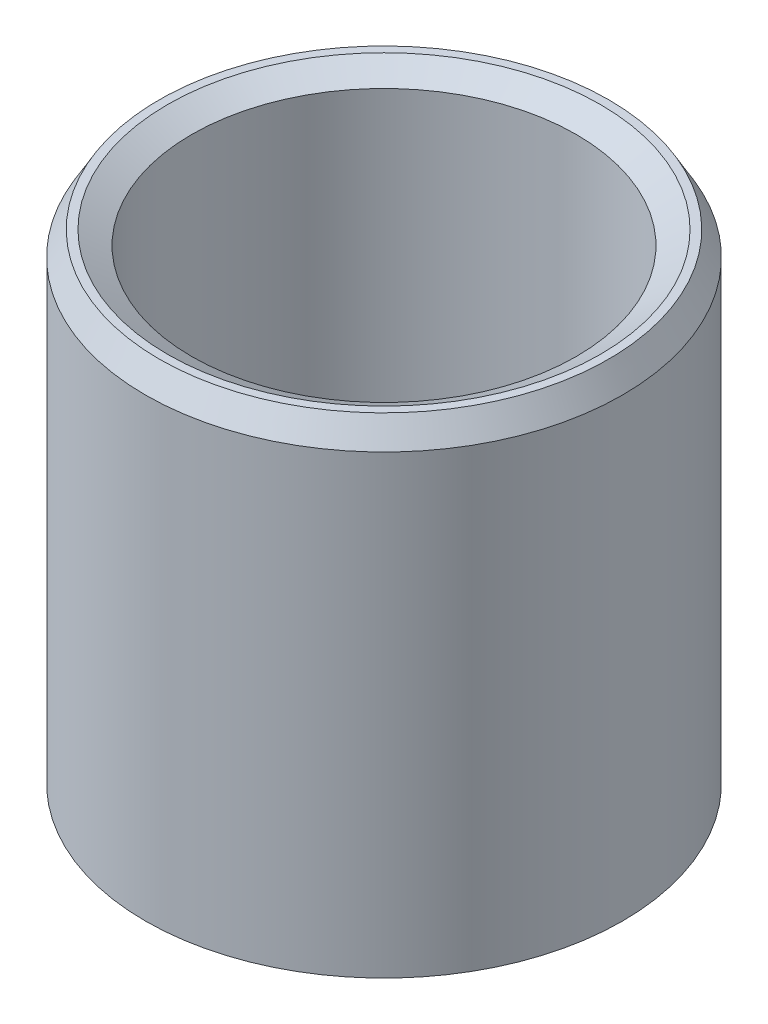
from build123d import *
from OCP.BRepFilletAPI import BRepFilletAPI_MakeChamfer

# Parameters (mm, degrees)
SKETCH1_R           = 35
BOSS_EXTRUDE1_DEPTH = 72.403703457
SKETCH2_R           = 28.211303246
CUT_EXTRUDE1_DEPTH  = 88.705736838
CHAMFER1_SIZE       = 3.533288169
CHAMFER1_SIZE2      = 2.039944876


with BuildPart() as part:
    # Sketch1 → Boss-Extrude1 (new body)
    with BuildSketch(Plane(origin=(0, 0, 0), x_dir=(1, 0, 0), z_dir=(0, 1, 0))):
        Circle(SKETCH1_R)
    extrude(amount=BOSS_EXTRUDE1_DEPTH)

    # Sketch2 → Cut-Extrude1 (cut, through all)
    with BuildSketch(Plane(origin=(0, 0, 0), x_dir=(1, 0, 0), z_dir=(0, 1, 0))):
        Circle(SKETCH2_R)
    extrude(amount=CUT_EXTRUDE1_DEPTH, mode=Mode.SUBTRACT)

    # Chamfer1: one chamfer whose edges measure the first distance from different faces: ONE call of the kernel's chamfer builder (chamfer() names one face for all edges)
    chamfer1_edges_1 = [part.edges().sort_by_distance(p)[0] for p in [
        (-28.211303246, 72.403703457, 0),
    ]]
    chamfer1_side_1 = [part.faces().sort_by_distance(p)[0] for p in [
        (-34.010050506, 72.403703457, 0),
    ]]
    chamfer1_edges_2 = [part.edges().sort_by_distance(p)[0] for p in [
        (-28.211303246, 0, 0),
    ]]
    chamfer1_side_2 = [part.faces().sort_by_distance(p)[0] for p in [
        (-28.211303246, 36.201851729, 0),
    ]]
    chamfer1_edges_3 = [part.edges().sort_by_distance(p)[0] for p in [
        (-35, 0, 0),
    ]]
    chamfer1_side_3 = [part.faces().sort_by_distance(p)[0] for p in [
        (-34.010050506, 0, 0),
    ]]
    chamfer1_edges_4 = [part.edges().sort_by_distance(p)[0] for p in [
        (-35, 72.403703457, 0),
    ]]
    chamfer1_side_4 = [part.faces().sort_by_distance(p)[0] for p in [
        (-35, 36.201851729, 0),
    ]]
    chamfer1 = BRepFilletAPI_MakeChamfer(part.part.solid().wrapped)
    for e in chamfer1_edges_1:
        chamfer1.Add(CHAMFER1_SIZE, CHAMFER1_SIZE2, e.wrapped, chamfer1_side_1[0].wrapped)  # the first distance lies on this face
    for e in chamfer1_edges_2:
        chamfer1.Add(CHAMFER1_SIZE, CHAMFER1_SIZE2, e.wrapped, chamfer1_side_2[0].wrapped)  # the first distance lies on this face
    for e in chamfer1_edges_3:
        chamfer1.Add(CHAMFER1_SIZE, CHAMFER1_SIZE2, e.wrapped, chamfer1_side_3[0].wrapped)  # the first distance lies on this face
    for e in chamfer1_edges_4:
        chamfer1.Add(CHAMFER1_SIZE, CHAMFER1_SIZE2, e.wrapped, chamfer1_side_4[0].wrapped)  # the first distance lies on this face
    add(Compound.cast(chamfer1.Shape()), mode=Mode.REPLACE)


solid = part.part
